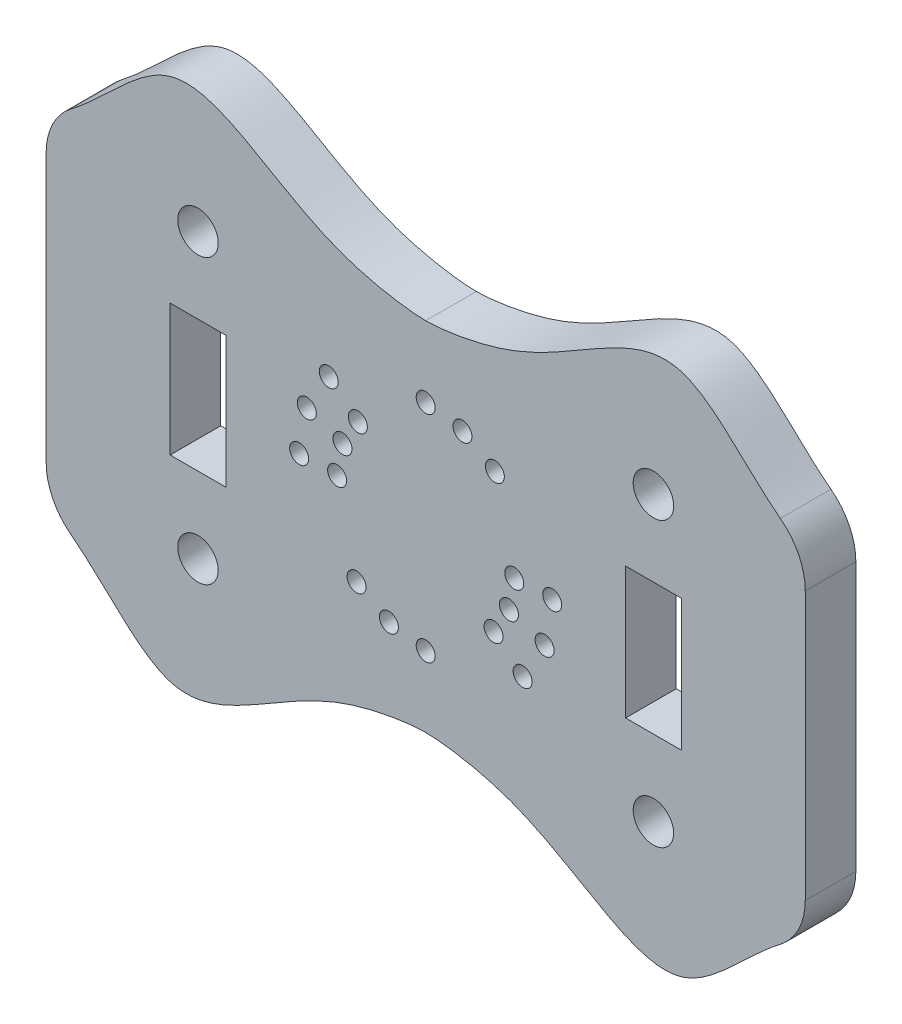
from build123d import *

# Parameters (mm, degrees)
SKETCH1_W           = 70
SKETCH1_H           = 60
BOSS_EXTRUDE1_DEPTH = 4
SKETCH7_W           = 4.4
SKETCH7_H           = 10.4
SKETCH7_W_2         = 4
SKETCH7_H_2         = 10
CUT_EXTRUDE5_DEPTH  = 4
CUT_EXTRUDE6_DEPTH  = 47.270941205
SKETCH10_R          = 1.6
CUT_EXTRUDE8_DEPTH  = 4
FILLET1_R           = 5
CUT_EXTRUDE10_DEPTH = 4
FILLET2_START       = -1
FILLET2_DEPTH       = 6
FILLET3_R           = 5
FILLET5_START       = -1
FILLET5_DEPTH       = 6
FILLET6_R           = 5
SKETCH12_R          = 0.75
CUT_EXTRUDE11_DEPTH = 10
SKETCH13_R          = 0.75
SKETCH13_R_2        = 1.6
SKETCH13_W          = 4.4
SKETCH13_H          = 10.4
BOSS_EXTRUDE2_DEPTH = 4
SKETCH14_W          = 15.15704438
SKETCH14_H          = 46.139826275
CUT_EXTRUDE12_DEPTH = 65.036629006


with BuildPart() as part:
    # Sketch1 → Boss-Extrude1 (new body)
    with BuildSketch(Plane.XY):
        Rectangle(SKETCH1_W, SKETCH1_H)
    extrude(amount=BOSS_EXTRUDE1_DEPTH)

    # Sketch7 → Cut-Extrude5 (cut)
    # profile 1 of 2: a face of its own
    with BuildSketch(Plane(origin=(0, 0, 0), x_dir=(-1, 0, 0), z_dir=(0, 0, -1))):
        with Locations((18, 0)):
            Rectangle(SKETCH7_W, SKETCH7_H)
        with Locations((18, 0)):
            Rectangle(SKETCH7_W_2, SKETCH7_H_2, mode=Mode.SUBTRACT)
    # profile 2 of 2: a face of its own
    with BuildSketch(Plane(origin=(0, 0, 0), x_dir=(-1, 0, 0), z_dir=(0, 0, -1))):
        with Locations((18, 0)):
            Rectangle(SKETCH7_W_2, SKETCH7_H_2)
    cut_extrude5 = extrude(amount=-CUT_EXTRUDE5_DEPTH, mode=Mode.SUBTRACT)

    # Sketch8 → Cut-Extrude6 (cut, through all)
    with BuildSketch(Plane.XY.offset(4)):
        with BuildLine():
            Line((35, -12.998257066), (35, -30))
            Line((35, -30), (-35, -30))
            Line((-35, -30), (-35, -12.998257066))
            add(Edge.make_bspline(
                [(-35, -12.998257066), (-28.534411353, -10.697329465), (-21.357986212, -26.957352276), (-10.036080548, -15.324626007), (-1.365587079, -14.095001393), (0, -14.095001393)],
                knots=[0, 0, 0, 0, 0.451542061, 0.822671476, 1, 1, 1, 1], degree=3))
            add(Edge.make_bspline(
                [(35, -12.998257066), (28.534411353, -10.697329465), (21.357986212, -26.957352276), (10.036080548, -15.324626007), (1.365587079, -14.095001393), (0, -14.095001393)],
                knots=[0, 0, 0, 0, 0.451542061, 0.822671476, 1, 1, 1, 1], degree=3))
        make_face()
        with BuildLine():
            Line((-35, 30), (-35, 12.998257066))
            add(Edge.make_bspline(
                [(-35, 12.998257066), (-28.534411353, 10.697329465), (-21.357986212, 26.957352276), (-10.036080548, 15.324626007), (-1.365587079, 14.095001393), (0, 14.095001393)],
                knots=[0, 0, 0, 0, 0.451542061, 0.822671476, 1, 1, 1, 1], degree=3))
            add(Edge.make_bspline(
                [(35, 12.998257066), (28.534411353, 10.697329465), (21.357986212, 26.957352276), (10.036080548, 15.324626007), (1.365587079, 14.095001393), (0, 14.095001393)],
                knots=[0, 0, 0, 0, 0.451542061, 0.822671476, 1, 1, 1, 1], degree=3))
            Line((35, 12.998257066), (35, 30))
            Line((35, 30), (-35, 30))
        make_face()
    extrude(amount=-CUT_EXTRUDE6_DEPTH, mode=Mode.SUBTRACT)

    # Sketch10 → Cut-Extrude8 (cut)
    with BuildSketch(Plane.XY.offset(4)):
        with Locations((-18, -11.2)):
            Circle(SKETCH10_R)
        with Locations((-18, 11.2)):
            Circle(SKETCH10_R)
    cut_extrude8 = extrude(amount=-CUT_EXTRUDE8_DEPTH, mode=Mode.SUBTRACT)

    # Mirror1: Cut-Extrude5, Cut-Extrude8 across plane
    add(cut_extrude5.mirror(Plane.ZY), mode=Mode.SUBTRACT)
    add(cut_extrude8.mirror(Plane.ZY), mode=Mode.SUBTRACT)

    # Fillet1
    fillet1_edges = [part.edges().sort_by_distance(p)[0] for p in [
        (35, 12.998257066, 2),
        (35, -12.998257066, 2),
        (-35, 12.998257066, 2),
        (-35, -12.998257066, 2),
    ]]
    fillet(fillet1_edges, radius=FILLET1_R)

    # Sketch11 → Cut-Extrude10 (cut)
    with BuildSketch(Plane.XY.offset(4)):
        with BuildLine():
            Line((-30, 13.010690925), (-30, -13.010690925))
            Line((-30, -13.010690925), (-31.308692305, -12.836385119))
            ThreePointArc((-31.308692305, -12.836385119), (-33.971363842, -11.048497574), (-35, -8.010690925))
            Line((-35, -8.010690925), (-35, 8.010690925))
            ThreePointArc((-35, 8.010690925), (-33.971363842, 11.048497574), (-31.308692305, 12.836385119))
            Line((-31.308692305, 12.836385119), (-30, 13.010690925))
        make_face()
        with BuildLine():
            Line((35, 8.010690925), (35, -8.010690925))
            ThreePointArc((35, -8.010690925), (33.971363842, -11.048497574), (31.308692305, -12.836385119))
            Line((31.308692305, -12.836385119), (30, -13.010690925))
            Line((30, -13.010690925), (30, 13.010690925))
            Line((30, 13.010690925), (31.308692305, 12.836385119))
            ThreePointArc((31.308692305, 12.836385119), (33.971363842, 11.048497574), (35, 8.010690925))
        make_face()
    extrude(amount=-CUT_EXTRUDE10_DEPTH, mode=Mode.SUBTRACT)

    # Fillet2: read off the stored shape, not the designer's step
    # Fillet2 outline → Fillet2 (cut)
    with BuildSketch(Plane.XY.offset(FILLET2_START)):
        with BuildLine():
            ThreePointArc((-30, 13.010690925), (-29.498217398, 13.513315592), (-28.930282081, 13.939774044))
            add(Edge.make_bspline(
                [(-31.308692305, 12.836385119), (-30.477527862, 13.061790722), (-29.688252314, 13.450735414), (-28.930282081, 13.939774044)],
                knots=[0.092733936, 0.092733936, 0.092733936, 0.092733936, 0.160216538, 0.160216538, 0.160216538, 0.160216538], degree=3))
            Line((-31.308692305, 12.836385119), (-30, 13.010690925))
        make_face()
        with BuildLine():
            ThreePointArc((28.930282081, 13.939774044), (29.498217398, 13.513315592), (30, 13.010690925))
            Line((30, 13.010690925), (31.308692305, 12.836385119))
            add(Edge.make_bspline(
                [(28.930282081, 13.939774044), (29.688252314, 13.450735414), (30.477527862, 13.061790722), (31.308692305, 12.836385119)],
                knots=[0.839783462, 0.839783462, 0.839783462, 0.839783462, 0.907266064, 0.907266064, 0.907266064, 0.907266064], degree=3))
        make_face()
        with BuildLine():
            ThreePointArc((30, -13.010690925), (29.498217398, -13.513315592), (28.930282081, -13.939774044))
            add(Edge.make_bspline(
                [(31.308692305, -12.836385119), (30.477527862, -13.061790722), (29.688252314, -13.450735414), (28.930282081, -13.939774044)],
                knots=[0.092733936, 0.092733936, 0.092733936, 0.092733936, 0.160216538, 0.160216538, 0.160216538, 0.160216538], degree=3))
            Line((31.308692305, -12.836385119), (30, -13.010690925))
        make_face()
    extrude(amount=FILLET2_DEPTH, mode=Mode.SUBTRACT)

    # Fillet3
    fillet3_edges = [part.edges().sort_by_distance(p)[0] for p in [
        (-30, 13.010690925, 2),
        (30, -13.010690925, 2),
        (30, 13.010690925, 2),
    ]]
    fillet(fillet3_edges, radius=FILLET3_R)

    # Fillet5: read off the stored shape, not the designer's step
    # Fillet5 outline → Fillet5 (cut)
    with BuildSketch(Plane.XY.offset(FILLET5_START)):
        with BuildLine():
            ThreePointArc((-28.930282081, -13.939774044), (-29.498217398, -13.513315592), (-30, -13.010690925))
            Line((-30, -13.010690925), (-31.308692305, -12.836385119))
            add(Edge.make_bspline(
                [(-28.930282081, -13.939774044), (-29.688252314, -13.450735414), (-30.477527862, -13.061790722), (-31.308692305, -12.836385119)],
                knots=[0.839783462, 0.839783462, 0.839783462, 0.839783462, 0.907266064, 0.907266064, 0.907266064, 0.907266064], degree=3))
        make_face()
    extrude(amount=FILLET5_DEPTH, mode=Mode.SUBTRACT)

    # Fillet6
    fillet6_edges = [part.edges().sort_by_distance(p)[0] for p in [
        (-30, -13.010690925, 2),
    ]]
    fillet(fillet6_edges, radius=FILLET6_R)

    # Sketch12 → Cut-Extrude11 (cut)
    with BuildSketch(Plane(origin=(0, 0, 0), x_dir=(-1, 0, 0), z_dir=(0, 0, -1))):
        with Locations((0, 8.5)):
            Circle(SKETCH12_R)
        with Locations((-2.907171218, 7.987387277)):
            Circle(SKETCH12_R)
        with Locations((-5.463694682, 6.511377767)):
            Circle(SKETCH12_R)
        with Locations((-7, -0.027136047)):
            Circle(SKETCH12_R)
        with Locations((-6.577848345, -2.394141003)):
            Circle(SKETCH12_R)
        with Locations((-5.362311102, -4.499513268)):
            Circle(SKETCH12_R)
        with Locations((-10, 0)):
            Circle(SKETCH12_R)
        with Locations((-9.396926208, -3.420201433)):
            Circle(SKETCH12_R)
        with Locations((-7.660444431, -6.427876097)):
            Circle(SKETCH12_R)
        with Locations((7.660444431, 6.427876097)):
            Circle(SKETCH12_R)
        with Locations((9.396926208, 3.420201433)):
            Circle(SKETCH12_R)
        with Locations((10, 0)):
            Circle(SKETCH12_R)
        with Locations((5.362311102, 4.499513268)):
            Circle(SKETCH12_R)
        with Locations((6.577848346, 2.394141003)):
            Circle(SKETCH12_R)
        with Locations((7, 0)):
            Circle(SKETCH12_R)
        with Locations((5.463694682, -6.511377766)):
            Circle(SKETCH12_R)
        with Locations((2.907171218, -7.987387277)):
            Circle(SKETCH12_R)
        with Locations((0, -8.5)):
            Circle(SKETCH12_R)
    extrude(amount=-CUT_EXTRUDE11_DEPTH, mode=Mode.SUBTRACT)

    # Sketch13 → Boss-Extrude2 (add)
    with BuildSketch(Plane.XY.offset(4)):
        with BuildLine():
            Line((-30, 10.597138601), (-30, -10.597138601))
            ThreePointArc((-30, -10.597138601), (-29.480331661, -12.816739513), (-28.029348717, -14.574957897))
            add(Edge.make_bspline(
                [(-28.029348717, -14.574957897), (-25.154266612, -16.764505896), (-19.236434423, -24.777557464), (-10.036080548, -15.324626007), (-1.365587079, -14.095001393), (0, -14.095001393)],
                knots=[0, 0, 0, 0, 0.26415737, 0.635286786, 0.812615309, 0.812615309, 0.812615309, 0.812615309], degree=3))
            add(Edge.make_bspline(
                [(0, -14.095001393), (1.365587079, -14.095001393), (10.036080548, -15.324626007), (19.236434423, -24.777557464), (25.154266612, -16.764505896), (28.029348717, -14.574957897)],
                knots=[0.187384691, 0.187384691, 0.187384691, 0.187384691, 0.364713214, 0.73584263, 1, 1, 1, 1], degree=3))
            ThreePointArc((28.029348717, -14.574957897), (29.480331661, -12.816739513), (30, -10.597138601))
            Line((30, -10.597138601), (30, 10.597138601))
            ThreePointArc((30, 10.597138601), (29.480331661, 12.816739513), (28.029348717, 14.574957897))
            add(Edge.make_bspline(
                [(28.029348717, 14.574957897), (25.154266612, 16.764505896), (19.236434423, 24.777557464), (10.036080548, 15.324626007), (1.365587079, 14.095001393), (0, 14.095001393)],
                knots=[0, 0, 0, 0, 0.26415737, 0.635286786, 0.812615309, 0.812615309, 0.812615309, 0.812615309], degree=3))
            add(Edge.make_bspline(
                [(0, 14.095001393), (-1.365587079, 14.095001393), (-10.036080548, 15.324626007), (-19.236434423, 24.777557464), (-25.154266612, 16.764505896), (-28.029348717, 14.574957897)],
                knots=[0.187384691, 0.187384691, 0.187384691, 0.187384691, 0.364713214, 0.73584263, 1, 1, 1, 1], degree=3))
            ThreePointArc((-28.029348717, 14.574957897), (-29.480331661, 12.816739513), (-30, 10.597138601))
        make_face()
        with Locations(Location((7.660444431, -6.427876097, 0), (0, 0, 180))):
            Circle(SKETCH13_R, mode=Mode.SUBTRACT)
        with Locations(Location((9.396926208, -3.420201433, 0), (0, 0, 180))):
            Circle(SKETCH13_R, mode=Mode.SUBTRACT)
        with Locations(Location((10, 0, 0), (0, 0, 180))):
            Circle(SKETCH13_R, mode=Mode.SUBTRACT)
        with Locations(Location((7, -0.027136047, 0), (0, 0, 180))):
            Circle(SKETCH13_R, mode=Mode.SUBTRACT)
        with Locations(Location((6.577848345, -2.394141003, 0), (0, 0, 180))):
            Circle(SKETCH13_R, mode=Mode.SUBTRACT)
        with Locations(Location((5.362311102, -4.499513268, 0), (0, 0, 180))):
            Circle(SKETCH13_R, mode=Mode.SUBTRACT)
        with Locations(Location((0, -8.5, 0), (0, 0, 180))):
            Circle(SKETCH13_R, mode=Mode.SUBTRACT)
        with Locations(Location((-2.907171218, -7.987387277, 0), (0, 0, 180))):
            Circle(SKETCH13_R, mode=Mode.SUBTRACT)
        with Locations(Location((-5.463694682, -6.511377766, 0), (0, 0, 180))):
            Circle(SKETCH13_R, mode=Mode.SUBTRACT)
        with Locations(Location((-7.660444431, 6.427876097, 0), (0, 0, 180))):
            Circle(SKETCH13_R, mode=Mode.SUBTRACT)
        with Locations(Location((-9.396926208, 3.420201433, 0), (0, 0, 180))):
            Circle(SKETCH13_R, mode=Mode.SUBTRACT)
        with Locations(Location((-10, 0, 0), (0, 0, 180))):
            Circle(SKETCH13_R, mode=Mode.SUBTRACT)
        with Locations(Location((-7, 0, 0), (0, 0, 180))):
            Circle(SKETCH13_R, mode=Mode.SUBTRACT)
        with Locations(Location((-6.577848346, 2.394141003, 0), (0, 0, 180))):
            Circle(SKETCH13_R, mode=Mode.SUBTRACT)
        with Locations(Location((-5.362311102, 4.499513268, 0), (0, 0, 180))):
            Circle(SKETCH13_R, mode=Mode.SUBTRACT)
        with Locations(Location((0, 8.5, 0), (0, 0, 180))):
            Circle(SKETCH13_R, mode=Mode.SUBTRACT)
        with Locations(Location((2.907171218, 7.987387277, 0), (0, 0, 180))):
            Circle(SKETCH13_R, mode=Mode.SUBTRACT)
        with Locations(Location((5.463694682, 6.511377767, 0), (0, 0, 180))):
            Circle(SKETCH13_R, mode=Mode.SUBTRACT)
        with Locations((18, 11.2)):
            Circle(SKETCH13_R_2, mode=Mode.SUBTRACT)
        with Locations((18, -11.2)):
            Circle(SKETCH13_R_2, mode=Mode.SUBTRACT)
        with Locations((-18, -11.2)):
            Circle(SKETCH13_R_2, mode=Mode.SUBTRACT)
        with Locations((-18, 11.2)):
            Circle(SKETCH13_R_2, mode=Mode.SUBTRACT)
        with Locations((18, 0)):
            Rectangle(SKETCH13_W, SKETCH13_H, mode=Mode.SUBTRACT)
        with Locations((-18, 0)):
            Rectangle(SKETCH13_W, SKETCH13_H, mode=Mode.SUBTRACT)
    extrude(amount=BOSS_EXTRUDE2_DEPTH)

    # Sketch14 → Cut-Extrude12 (cut, through all)
    with BuildSketch(Plane.ZY.offset(30)):
        with Locations((-3.57852219, -0.612968707)):
            Rectangle(SKETCH14_W, SKETCH14_H)
    extrude(amount=-CUT_EXTRUDE12_DEPTH, mode=Mode.SUBTRACT)


solid = part.part
